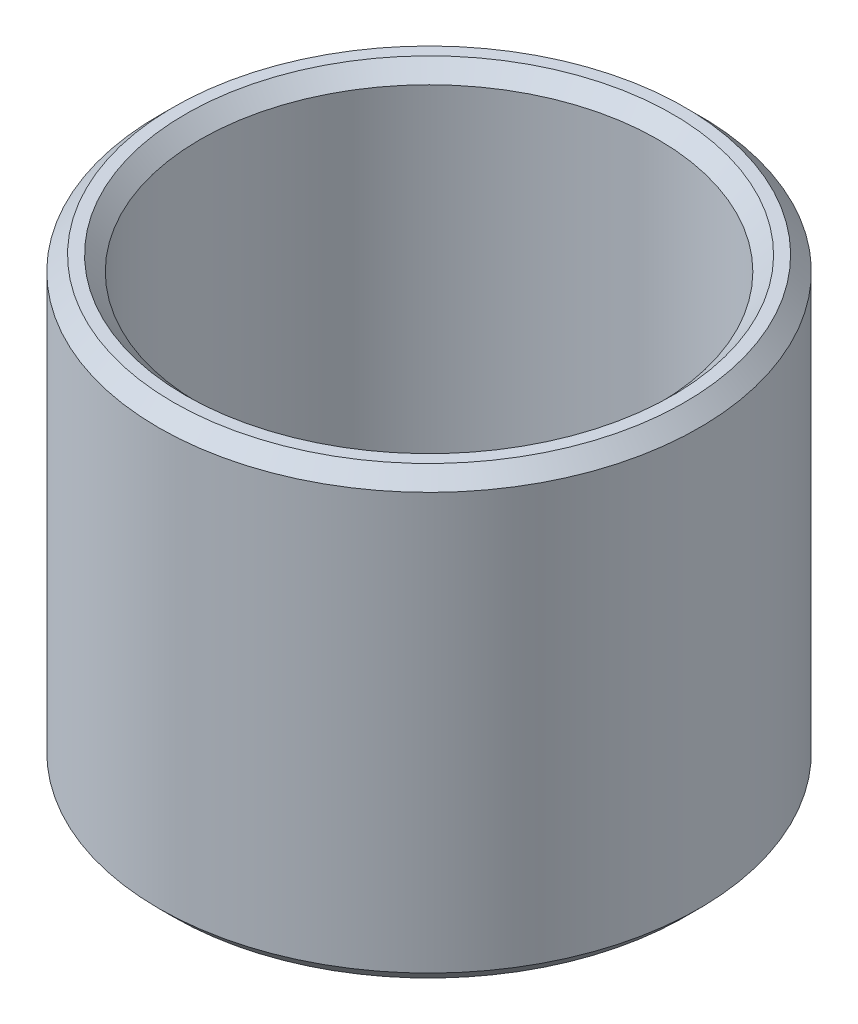
from build123d import *

# Parameters (mm, degrees)
SKETCH1_R           = 57.5
BOSS_EXTRUDE1_DEPTH = 94.785020664
SKETCH2_R           = 48.699563652
CUT_EXTRUDE1_DEPTH  = 125.886749266
CHAMFER1_SIZE       = 3.118522989


with BuildPart() as part:
    # Sketch1 → Boss-Extrude1 (new body)
    with BuildSketch(Plane(origin=(0, 0, 0), x_dir=(1, 0, 0), z_dir=(0, 1, 0))):
        Circle(SKETCH1_R)
    extrude(amount=BOSS_EXTRUDE1_DEPTH)

    # Sketch2 → Cut-Extrude1 (cut, through all)
    with BuildSketch(Plane(origin=(0, 0, 0), x_dir=(1, 0, 0), z_dir=(0, 1, 0))):
        Circle(SKETCH2_R)
    extrude(amount=CUT_EXTRUDE1_DEPTH, mode=Mode.SUBTRACT)

    # Chamfer1
    chamfer1_edges = [part.edges().sort_by_distance(p)[0] for p in [
        (-48.699563652, 94.785020664, 0),
        (-48.699563652, 0, 0),
        (-57.5, 0, 0),
        (-57.5, 94.785020664, 0),
    ]]
    chamfer(chamfer1_edges, length=CHAMFER1_SIZE)


solid = part.part
